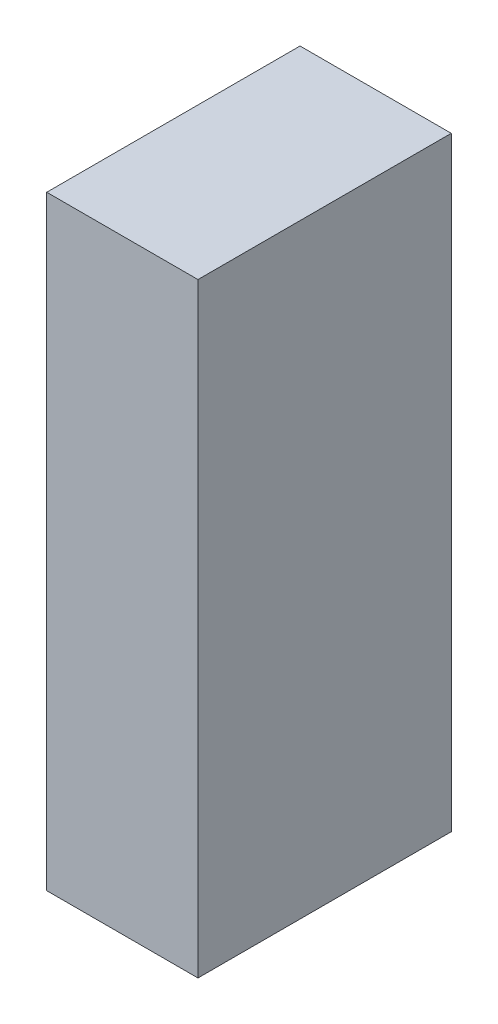
from build123d import *

# Parameters (mm, degrees)
SKETCH1_W           = 33.5
SKETCH1_H           = 80
BOSS_EXTRUDE1_DEPTH = 20


with BuildPart() as part:
    # Sketch1 → Boss-Extrude1 (new body)
    with BuildSketch(Plane(origin=(0, 0, 0), x_dir=(0, 0, -1), z_dir=(1, 0, 0))):
        Rectangle(SKETCH1_W, SKETCH1_H)
    extrude(amount=BOSS_EXTRUDE1_DEPTH)


solid = part.part
